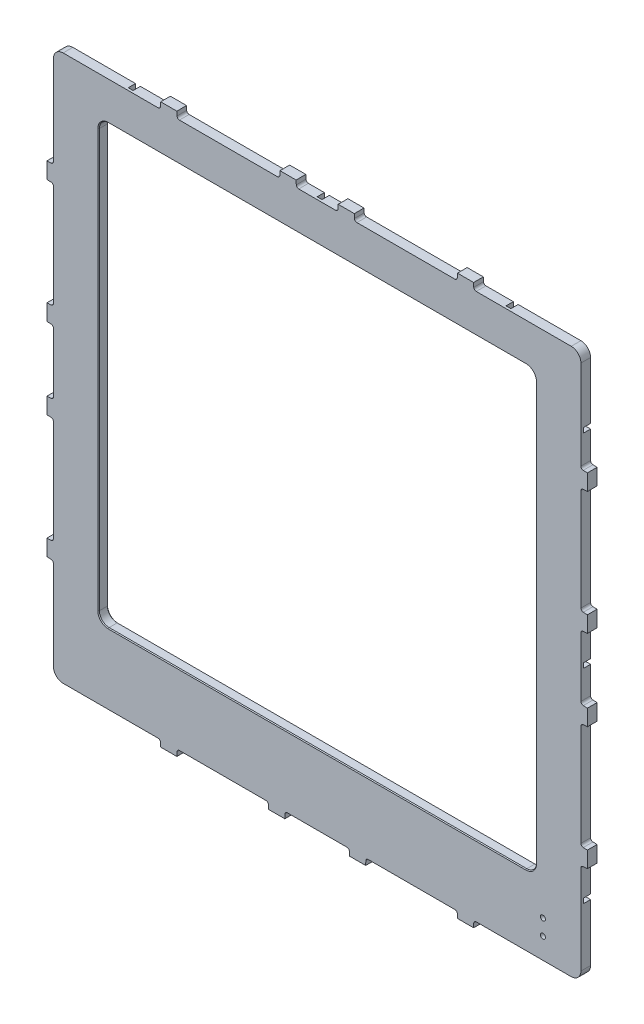
from build123d import *

# Parameters (mm, degrees)
CROQUIS1_W                          = 334.2
CROQUIS1_H                          = 345.6
SALIENTE_EXTRUIR1_DEPTH             = 6
CROQUIS2_W                          = 70.210316922
CROQUIS2_H                          = 4
CORTAR_EXTRUIR1_DEPTH               = 241.454257604
CROQUIS3_W                          = 4
CROQUIS3_H                          = 62.8
CORTAR_EXTRUIR2_DEPTH               = 241.454257604
CROQUIS4_W                          = 4
CROQUIS4_H                          = 66.660316922
CORTAR_EXTRUIR3_DEPTH               = 241.454257604
CROQUIS5_W                          = 66.35
CROQUIS5_H                          = 4
CORTAR_EXTRUIR4_DEPTH               = 241.454257604
CROQUIS6_W                          = 25.720633844
CROQUIS6_H                          = 4
CORTAR_EXTRUIR5_DEPTH               = 241.454257604
CROQUIS7_W                          = 70.210316922
CROQUIS7_H                          = 4
CORTAR_EXTRUIR6_DEPTH               = 241.454257604
CROQUIS8_W                          = 4
CROQUIS8_H                          = 62.8
CORTAR_EXTRUIR7_DEPTH               = 241.454257604
CROQUIS9_W                          = 4
CROQUIS9_H                          = 39.720633844
CORTAR_EXTRUIR8_DEPTH               = 241.454257604
CROQUIS10_W                         = 4
CROQUIS10_H                         = 66.660316922
CORTAR_EXTRUIR9_DEPTH               = 241.454257604
CROQUIS11_W                         = 66.210316922
CROQUIS11_H                         = 4
CORTAR_EXTRUIR10_DEPTH              = 241.454257604
CROQUIS12_W                         = 56.470633844
CROQUIS12_H                         = 4
CORTAR_EXTRUIR11_DEPTH              = 241.454257604
CORTAR_EXTRUIR12_DEPTH              = 4.5
CORTAR_EXTRUIR13_DEPTH              = 4.5
CORTAR_EXTRUIR14_DEPTH              = 4.5
CORTAR_EXTRUIR15_DEPTH              = 4.5
CORTAR_EXTRUIR16_DEPTH              = 4.5
CORTAR_EXTRUIR17_DEPTH              = 4.5
CORTAR_EXTRUIR18_DEPTH              = 4.5
CORTAR_EXTRUIR19_DEPTH              = 4.5
CORTAR_EXTRUIR20_DEPTH              = 4.5
CORTAR_EXTRUIR21_DEPTH              = 4.5
CORTAR_EXTRUIR22_DEPTH              = 4.5
CORTAR_EXTRUIR23_DEPTH              = 4.5
CORTAR_EXTRUIR24_DEPTH              = 4.5
CORTAR_EXTRUIR25_DEPTH              = 4.5
CORTAR_EXTRUIR26_DEPTH              = 241.454257604
CROQUIS29_W                         = 4
CROQUIS29_H                         = 65.720633844
CORTAR_EXTRUIR27_DEPTH              = 241.454257604
CORTAR_EXTRUIR28_DEPTH              = 241.454257604
CROQUIS31_W                         = 63.470633844
CROQUIS31_H                         = 4
CORTAR_EXTRUIR29_DEPTH              = 241.454257604
CORTAR_EXTRUIR30_DEPTH              = 241.454257604
CROQUIS33_W                         = 4
CROQUIS33_H                         = 65.720633844
CORTAR_EXTRUIR31_DEPTH              = 241.454257604
CROQUIS34_W                         = 39.720633844
CROQUIS34_H                         = 4
CORTAR_EXTRUIR32_DEPTH              = 241.454257604
CROQUIS35_W                         = 270.3
CROQUIS35_H                         = 270.251727153
CORTAR_EXTRUIR33_DEPTH              = 241.454257604
NGULO_DE_SALIDA1_ANGLE              = 2
NGULO_DE_SALIDA2_ANGLE              = 2
NGULO_DE_SALIDA3_ANGLE              = 2
NGULO_DE_SALIDA4_ANGLE              = 2
NGULO_DE_SALIDA5_ANGLE              = 2
NGULO_DE_SALIDA6_ANGLE              = 2
NGULO_DE_SALIDA7_ANGLE              = 2
NGULO_DE_SALIDA8_ANGLE              = 2
NGULO_DE_SALIDA9_ANGLE              = 2
NGULO_DE_SALIDA10_ANGLE             = 2
NGULO_DE_SALIDA11_ANGLE             = 2
NGULO_DE_SALIDA12_ANGLE             = 2
NGULO_DE_SALIDA13_ANGLE             = 2
NGULO_DE_SALIDA14_ANGLE             = 2
NGULO_DE_SALIDA15_ANGLE             = 2
NGULO_DE_SALIDA16_ANGLE             = 2
NGULO_DE_SALIDA17_ANGLE             = 2
DI_METRO_DE_TALADRO_3_1_3_1_1_D     = 3.1
DI_METRO_DE_TALADRO_12_0_12_1_D     = 12
DI_METRO_DE_TALADRO_12_0_12_1_DEPTH = 4.5
REDONDEO1_R                         = 6
CHAFL_N1_SIZE                       = 0.5
REDONDEO2_R                         = 1.5


with BuildPart() as part:
    # Croquis1 → Saliente-Extruir1 (new body)
    with BuildSketch(Plane(origin=(0, 0, -3), x_dir=(-1, 0, 0), z_dir=(0, 0, -1))):
        Rectangle(CROQUIS1_W, CROQUIS1_H)
    extrude(amount=-SALIENTE_EXTRUIR1_DEPTH)

    # Croquis2 → Cortar-Extruir1 (cut, through all)
    with BuildSketch(Plane.XY.offset(3)):
        with Locations((-131.994841539, -170.8)):
            Rectangle(CROQUIS2_W, CROQUIS2_H)
    extrude(amount=-CORTAR_EXTRUIR1_DEPTH, mode=Mode.SUBTRACT)

    # Croquis3 → Cortar-Extruir2 (cut, through all)
    with BuildSketch(Plane.XY.offset(3)):
        with Locations((-165.1, -137.4)):
            Rectangle(CROQUIS3_W, CROQUIS3_H)
    extrude(amount=-CORTAR_EXTRUIR2_DEPTH, mode=Mode.SUBTRACT)

    # Croquis4 → Cortar-Extruir3 (cut, through all)
    with BuildSketch(Plane.XY.offset(3)):
        with Locations((-165.1, 139.469841539)):
            Rectangle(CROQUIS4_W, CROQUIS4_H)
    extrude(amount=-CORTAR_EXTRUIR3_DEPTH, mode=Mode.SUBTRACT)

    # Croquis5 → Cortar-Extruir4 (cut, through all)
    with BuildSketch(Plane.XY.offset(3)):
        with Locations((-129.925, 170.8)):
            Rectangle(CROQUIS5_W, CROQUIS5_H)
    extrude(amount=-CORTAR_EXTRUIR4_DEPTH, mode=Mode.SUBTRACT)

    # Croquis6 → Cortar-Extruir5 (cut, through all)
    with BuildSketch(Plane.XY.offset(3)):
        with Locations((0, 170.8)):
            Rectangle(CROQUIS6_W, CROQUIS6_H)
    extrude(amount=-CORTAR_EXTRUIR5_DEPTH, mode=Mode.SUBTRACT)

    # Croquis7 → Cortar-Extruir6 (cut, through all)
    with BuildSketch(Plane.XY.offset(3)):
        with Locations((131.994841539, 170.8)):
            Rectangle(CROQUIS7_W, CROQUIS7_H)
    extrude(amount=-CORTAR_EXTRUIR6_DEPTH, mode=Mode.SUBTRACT)

    # Croquis8 → Cortar-Extruir7 (cut, through all)
    with BuildSketch(Plane.XY.offset(3)):
        with Locations((165.1, 137.4)):
            Rectangle(CROQUIS8_W, CROQUIS8_H)
    extrude(amount=-CORTAR_EXTRUIR7_DEPTH, mode=Mode.SUBTRACT)

    # Croquis9 → Cortar-Extruir8 (cut, through all)
    with BuildSketch(Plane.XY.offset(3)):
        with Locations((165.1, 0)):
            Rectangle(CROQUIS9_W, CROQUIS9_H)
    cortar_extruir8 = extrude(amount=-CORTAR_EXTRUIR8_DEPTH, mode=Mode.SUBTRACT)

    # Croquis10 → Cortar-Extruir9 (cut, through all)
    with BuildSketch(Plane.XY.offset(3)):
        with Locations((165.1, -139.469841539)):
            Rectangle(CROQUIS10_W, CROQUIS10_H)
    extrude(amount=-CORTAR_EXTRUIR9_DEPTH, mode=Mode.SUBTRACT)

    # Croquis11 → Cortar-Extruir10 (cut, through all)
    with BuildSketch(Plane.XY.offset(3)):
        with Locations((129.994841539, -170.8)):
            Rectangle(CROQUIS11_W, CROQUIS11_H)
    extrude(amount=-CORTAR_EXTRUIR10_DEPTH, mode=Mode.SUBTRACT)

    # Croquis12 → Cortar-Extruir11 (cut, through all)
    with BuildSketch(Plane.XY.offset(3)):
        with Locations((58.375, -170.8)):
            Rectangle(CROQUIS12_W, CROQUIS12_H)
    cortar_extruir11 = extrude(amount=-CORTAR_EXTRUIR11_DEPTH, mode=Mode.SUBTRACT)

    # Croquis13 → Cortar-Extruir12 (cut)
    with BuildSketch(Plane(origin=(0, 0, -3), x_dir=(-1, 0, 0), z_dir=(0, 0, -1))):
        with BuildLine():
            Line((-1.5, 168.8), (-1.5, 162.479019946))
            ThreePointArc((-1.5, 162.479019946), (-2.395643924, 161.968245837), (-2.75, 161))
            Line((-2.75, 161), (-2.75, 159.6))
            ThreePointArc((-2.75, 159.6), (-2.395643924, 158.631754163), (-1.5, 158.120980054))
            Line((-1.5, 158.120980054), (1.5, 158.120980054))
            ThreePointArc((1.5, 158.120980054), (2.395643924, 158.631754163), (2.75, 159.6))
            Line((2.75, 159.6), (2.75, 161))
            ThreePointArc((2.75, 161), (2.395643924, 161.968245837), (1.5, 162.479019946))
            Line((1.5, 162.479019946), (1.5, 168.8))
            Line((1.5, 168.8), (-1.5, 168.8))
        make_face()
    extrude(amount=-CORTAR_EXTRUIR12_DEPTH, mode=Mode.SUBTRACT)

    # Croquis14 → Cortar-Extruir13 (cut)
    with BuildSketch(Plane(origin=(0, 0, -3), x_dir=(-1, 0, 0), z_dir=(0, 0, -1))):
        with BuildLine():
            Line((-118.3, 168.8), (-118.3, 162.479019946))
            ThreePointArc((-118.3, 162.479019946), (-119.195643924, 161.968245837), (-119.55, 161))
            Line((-119.55, 161), (-119.55, 159.6))
            ThreePointArc((-119.55, 159.6), (-119.195643924, 158.631754163), (-118.3, 158.120980054))
            Line((-118.3, 158.120980054), (-115.3, 158.120980054))
            ThreePointArc((-115.3, 158.120980054), (-114.404356076, 158.631754163), (-114.05, 159.6))
            Line((-114.05, 159.6), (-114.05, 161))
            ThreePointArc((-114.05, 161), (-114.404356076, 161.968245837), (-115.3, 162.479019946))
            Line((-115.3, 162.479019946), (-115.3, 168.8))
            Line((-115.3, 168.8), (-118.3, 168.8))
        make_face()
    cortar_extruir13 = extrude(amount=-CORTAR_EXTRUIR13_DEPTH, mode=Mode.SUBTRACT)

    # Croquis15 → Cortar-Extruir14 (cut)
    with BuildSketch(Plane(origin=(0, 0, -3), x_dir=(-1, 0, 0), z_dir=(0, 0, -1))):
        with BuildLine():
            Line((-163.1, 124.5), (-156.779019946, 124.5))
            ThreePointArc((-156.779019946, 124.5), (-156.268245837, 123.604356076), (-155.3, 123.25))
            Line((-155.3, 123.25), (-153.9, 123.25))
            ThreePointArc((-153.9, 123.25), (-152.931754163, 123.604356076), (-152.420980054, 124.5))
            Line((-152.420980054, 124.5), (-152.420980054, 127.5))
            ThreePointArc((-152.420980054, 127.5), (-152.931754163, 128.395643924), (-153.9, 128.75))
            Line((-153.9, 128.75), (-155.3, 128.75))
            ThreePointArc((-155.3, 128.75), (-156.268245837, 128.395643924), (-156.779019946, 127.5))
            Line((-156.779019946, 127.5), (-163.1, 127.5))
            Line((-163.1, 127.5), (-163.1, 124.5))
        make_face()
    cortar_extruir14 = extrude(amount=-CORTAR_EXTRUIR14_DEPTH, mode=Mode.SUBTRACT)

    # Croquis16 → Cortar-Extruir15 (cut)
    with BuildSketch(Plane(origin=(0, 0, -3), x_dir=(-1, 0, 0), z_dir=(0, 0, -1))):
        with BuildLine():
            Line((-163.1, -1.5), (-156.779019946, -1.5))
            ThreePointArc((-156.779019946, -1.5), (-156.268245837, -2.395643924), (-155.3, -2.75))
            Line((-155.3, -2.75), (-153.9, -2.75))
            ThreePointArc((-153.9, -2.75), (-152.931754163, -2.395643924), (-152.420980054, -1.5))
            Line((-152.420980054, -1.5), (-152.420980054, 1.5))
            ThreePointArc((-152.420980054, 1.5), (-152.931754163, 2.395643924), (-153.9, 2.75))
            Line((-153.9, 2.75), (-155.3, 2.75))
            ThreePointArc((-155.3, 2.75), (-156.268245837, 2.395643924), (-156.779019946, 1.5))
            Line((-156.779019946, 1.5), (-163.1, 1.5))
            Line((-163.1, 1.5), (-163.1, -1.5))
        make_face()
    cortar_extruir15 = extrude(amount=-CORTAR_EXTRUIR15_DEPTH, mode=Mode.SUBTRACT)

    # Croquis17 → Cortar-Extruir16 (cut)
    with BuildSketch(Plane(origin=(0, 0, -3), x_dir=(-1, 0, 0), z_dir=(0, 0, -1))):
        with BuildLine():
            Line((-163.1, -127.5), (-156.779019946, -127.5))
            ThreePointArc((-156.779019946, -127.5), (-156.268245837, -128.395643924), (-155.3, -128.75))
            Line((-155.3, -128.75), (-153.9, -128.75))
            ThreePointArc((-153.9, -128.75), (-152.931754163, -128.395643924), (-152.420980054, -127.5))
            Line((-152.420980054, -127.5), (-152.420980054, -124.5))
            ThreePointArc((-152.420980054, -124.5), (-152.931754163, -123.604356076), (-153.9, -123.25))
            Line((-153.9, -123.25), (-155.3, -123.25))
            ThreePointArc((-155.3, -123.25), (-156.268245837, -123.604356076), (-156.779019946, -124.5))
            Line((-156.779019946, -124.5), (-163.1, -124.5))
            Line((-163.1, -124.5), (-163.1, -127.5))
        make_face()
    cortar_extruir16 = extrude(amount=-CORTAR_EXTRUIR16_DEPTH, mode=Mode.SUBTRACT)

    # Croquis18 → Cortar-Extruir17 (cut)
    with BuildSketch(Plane(origin=(0, 0, -3), x_dir=(-1, 0, 0), z_dir=(0, 0, -1))):
        with BuildLine():
            Line((-115.3, -168.8), (-115.3, -162.479019946))
            ThreePointArc((-115.3, -162.479019946), (-114.404356076, -161.968245837), (-114.05, -161))
            Line((-114.05, -161), (-114.05, -159.6))
            ThreePointArc((-114.05, -159.6), (-114.404356076, -158.631754163), (-115.3, -158.120980054))
            Line((-115.3, -158.120980054), (-118.3, -158.120980054))
            ThreePointArc((-118.3, -158.120980054), (-119.195643924, -158.631754163), (-119.55, -159.6))
            Line((-119.55, -159.6), (-119.55, -161))
            ThreePointArc((-119.55, -161), (-119.195643924, -161.968245837), (-118.3, -162.479019946))
            Line((-118.3, -162.479019946), (-118.3, -168.8))
            Line((-118.3, -168.8), (-115.3, -168.8))
        make_face()
    cortar_extruir17 = extrude(amount=-CORTAR_EXTRUIR17_DEPTH, mode=Mode.SUBTRACT)

    # Croquis19 → Cortar-Extruir18 (cut)
    with BuildSketch(Plane(origin=(0, 0, -3), x_dir=(-1, 0, 0), z_dir=(0, 0, -1))):
        with BuildLine():
            Line((-56.9, -168.8), (-56.9, -162.479019946))
            ThreePointArc((-56.9, -162.479019946), (-56.004356076, -161.968245837), (-55.65, -161))
            Line((-55.65, -161), (-55.65, -159.6))
            ThreePointArc((-55.65, -159.6), (-56.004356076, -158.631754163), (-56.9, -158.120980054))
            Line((-56.9, -158.120980054), (-59.9, -158.120980054))
            ThreePointArc((-59.9, -158.120980054), (-60.795643924, -158.631754163), (-61.15, -159.6))
            Line((-61.15, -159.6), (-61.15, -161))
            ThreePointArc((-61.15, -161), (-60.795643924, -161.968245837), (-59.9, -162.479019946))
            Line((-59.9, -162.479019946), (-59.9, -168.8))
            Line((-59.9, -168.8), (-56.9, -168.8))
        make_face()
    cortar_extruir18 = extrude(amount=-CORTAR_EXTRUIR18_DEPTH, mode=Mode.SUBTRACT)

    # Croquis20 → Cortar-Extruir19 (cut)
    with BuildSketch(Plane(origin=(0, 0, -3), x_dir=(-1, 0, 0), z_dir=(0, 0, -1))):
        with BuildLine():
            Line((-59.737509594, -158.120980054), (-57.062490406, -158.120980054))
            ThreePointArc((-57.062490406, -158.120980054), (-58.4, -157.3), (-59.737509594, -158.120980054))
        make_face()
    cortar_extruir19 = extrude(amount=-CORTAR_EXTRUIR19_DEPTH, mode=Mode.SUBTRACT)

    # Croquis21 → Cortar-Extruir20 (cut)
    with BuildSketch(Plane(origin=(0, 0, -3), x_dir=(-1, 0, 0), z_dir=(0, 0, -1))):
        with BuildLine():
            Line((-118.137509594, -158.120980054), (-115.462490406, -158.120980054))
            ThreePointArc((-115.462490406, -158.120980054), (-116.8, -157.3), (-118.137509594, -158.120980054))
        make_face()
    cortar_extruir20 = extrude(amount=-CORTAR_EXTRUIR20_DEPTH, mode=Mode.SUBTRACT)

    # Croquis22 → Cortar-Extruir21 (cut)
    with BuildSketch(Plane(origin=(0, 0, -3), x_dir=(-1, 0, 0), z_dir=(0, 0, -1))):
        with BuildLine():
            Line((-152.420980054, -124.662490406), (-152.420980054, -127.337509594))
            ThreePointArc((-152.420980054, -127.337509594), (-151.6, -126), (-152.420980054, -124.662490406))
        make_face()
    cortar_extruir21 = extrude(amount=-CORTAR_EXTRUIR21_DEPTH, mode=Mode.SUBTRACT)

    # Croquis23 → Cortar-Extruir22 (cut)
    with BuildSketch(Plane(origin=(0, 0, -3), x_dir=(-1, 0, 0), z_dir=(0, 0, -1))):
        with BuildLine():
            Line((-152.420980054, 1.337509594), (-152.420980054, -1.337509594))
            ThreePointArc((-152.420980054, -1.337509594), (-151.6, 0), (-152.420980054, 1.337509594))
        make_face()
    cortar_extruir22 = extrude(amount=-CORTAR_EXTRUIR22_DEPTH, mode=Mode.SUBTRACT)

    # Croquis24 → Cortar-Extruir23 (cut)
    with BuildSketch(Plane(origin=(0, 0, -3), x_dir=(-1, 0, 0), z_dir=(0, 0, -1))):
        with BuildLine():
            Line((-152.420980054, 127.337509594), (-152.420980054, 124.662490406))
            ThreePointArc((-152.420980054, 124.662490406), (-151.6, 126), (-152.420980054, 127.337509594))
        make_face()
    cortar_extruir23 = extrude(amount=-CORTAR_EXTRUIR23_DEPTH, mode=Mode.SUBTRACT)

    # Croquis25 → Cortar-Extruir24 (cut)
    with BuildSketch(Plane(origin=(0, 0, -3), x_dir=(-1, 0, 0), z_dir=(0, 0, -1))):
        with BuildLine():
            Line((-115.462490406, 158.120980054), (-118.137509594, 158.120980054))
            ThreePointArc((-118.137509594, 158.120980054), (-116.8, 157.3), (-115.462490406, 158.120980054))
        make_face()
    cortar_extruir24 = extrude(amount=-CORTAR_EXTRUIR24_DEPTH, mode=Mode.SUBTRACT)

    # Simetría1: Cortar-Extruir8, Cortar-Extruir11, Cortar-Extruir13, Cortar-Extruir14, Cortar-Extruir15, Cortar-Extruir16, Cortar-Extruir17, Cortar-Extruir18, Cortar-Extruir19, Cortar-Extruir20, Cortar-Extruir21, Cortar-Extruir22, Cortar-Extruir23, Cortar-Extruir24 across plane
    add(cortar_extruir8.mirror(Plane(origin=(0, 0, 0), x_dir=(0, 0, 1), z_dir=(1, 0, 0))), mode=Mode.SUBTRACT)
    add(cortar_extruir11.mirror(Plane(origin=(0, 0, 0), x_dir=(0, 0, 1), z_dir=(1, 0, 0))), mode=Mode.SUBTRACT)
    add(cortar_extruir13.mirror(Plane(origin=(0, 0, 0), x_dir=(0, 0, 1), z_dir=(1, 0, 0))), mode=Mode.SUBTRACT)
    add(cortar_extruir14.mirror(Plane(origin=(0, 0, 0), x_dir=(0, 0, 1), z_dir=(1, 0, 0))), mode=Mode.SUBTRACT)
    add(cortar_extruir15.mirror(Plane(origin=(0, 0, 0), x_dir=(0, 0, 1), z_dir=(1, 0, 0))), mode=Mode.SUBTRACT)
    add(cortar_extruir16.mirror(Plane(origin=(0, 0, 0), x_dir=(0, 0, 1), z_dir=(1, 0, 0))), mode=Mode.SUBTRACT)
    add(cortar_extruir17.mirror(Plane(origin=(0, 0, 0), x_dir=(0, 0, 1), z_dir=(1, 0, 0))), mode=Mode.SUBTRACT)
    add(cortar_extruir18.mirror(Plane(origin=(0, 0, 0), x_dir=(0, 0, 1), z_dir=(1, 0, 0))), mode=Mode.SUBTRACT)
    add(cortar_extruir19.mirror(Plane(origin=(0, 0, 0), x_dir=(0, 0, 1), z_dir=(1, 0, 0))), mode=Mode.SUBTRACT)
    add(cortar_extruir20.mirror(Plane(origin=(0, 0, 0), x_dir=(0, 0, 1), z_dir=(1, 0, 0))), mode=Mode.SUBTRACT)
    add(cortar_extruir21.mirror(Plane(origin=(0, 0, 0), x_dir=(0, 0, 1), z_dir=(1, 0, 0))), mode=Mode.SUBTRACT)
    add(cortar_extruir22.mirror(Plane(origin=(0, 0, 0), x_dir=(0, 0, 1), z_dir=(1, 0, 0))), mode=Mode.SUBTRACT)
    add(cortar_extruir23.mirror(Plane(origin=(0, 0, 0), x_dir=(0, 0, 1), z_dir=(1, 0, 0))), mode=Mode.SUBTRACT)
    add(cortar_extruir24.mirror(Plane(origin=(0, 0, 0), x_dir=(0, 0, 1), z_dir=(1, 0, 0))), mode=Mode.SUBTRACT)

    # Croquis27 → Cortar-Extruir25 (cut)
    with BuildSketch(Plane(origin=(0, 0, -3), x_dir=(-1, 0, 0), z_dir=(0, 0, -1))):
        with BuildLine():
            Line((1.337509594, 158.120980054), (-1.337509594, 158.120980054))
            ThreePointArc((-1.337509594, 158.120980054), (0, 157.3), (1.337509594, 158.120980054))
        make_face()
    extrude(amount=-CORTAR_EXTRUIR25_DEPTH, mode=Mode.SUBTRACT)

    # Croquis28 → Cortar-Extruir26 (cut, through all)
    with BuildSketch(Plane.XY.offset(3)):
        Polygon((-167.1, -30), (-167.1, -96), (-163.1, -96), (-163.1, -30.139683078), align=None)
    extrude(amount=-CORTAR_EXTRUIR26_DEPTH, mode=Mode.SUBTRACT)

    # Croquis29 → Cortar-Extruir27 (cut, through all)
    with BuildSketch(Plane.XY.offset(3)):
        with Locations((-165.1, 63)):
            Rectangle(CROQUIS29_W, CROQUIS29_H)
    extrude(amount=-CORTAR_EXTRUIR27_DEPTH, mode=Mode.SUBTRACT)

    # Croquis30 → Cortar-Extruir28 (cut, through all)
    with BuildSketch(Plane.XY.offset(3)):
        Polygon((-23, 172.8), (-86.75, 172.8), (-86.75, 168.8), (-23.139683078, 168.8), align=None)
    extrude(amount=-CORTAR_EXTRUIR28_DEPTH, mode=Mode.SUBTRACT)

    # Croquis31 → Cortar-Extruir29 (cut, through all)
    with BuildSketch(Plane.XY.offset(3)):
        with Locations((54.875, 170.8)):
            Rectangle(CROQUIS31_W, CROQUIS31_H)
    extrude(amount=-CORTAR_EXTRUIR29_DEPTH, mode=Mode.SUBTRACT)

    # Croquis32 → Cortar-Extruir30 (cut, through all)
    with BuildSketch(Plane.XY.offset(3)):
        Polygon((167.1, 96), (163.1, 96), (163.1, 30.139683078), (167.1, 30), align=None)
    extrude(amount=-CORTAR_EXTRUIR30_DEPTH, mode=Mode.SUBTRACT)

    # Croquis33 → Cortar-Extruir31 (cut, through all)
    with BuildSketch(Plane.XY.offset(3)):
        with Locations((165.1, -63)):
            Rectangle(CROQUIS33_W, CROQUIS33_H)
    extrude(amount=-CORTAR_EXTRUIR31_DEPTH, mode=Mode.SUBTRACT)

    # Croquis34 → Cortar-Extruir32 (cut, through all)
    with BuildSketch(Plane.XY.offset(3)):
        with Locations((0, -170.8)):
            Rectangle(CROQUIS34_W, CROQUIS34_H)
    extrude(amount=-CORTAR_EXTRUIR32_DEPTH, mode=Mode.SUBTRACT)

    # Croquis35 → Cortar-Extruir33 (cut, through all)
    with BuildSketch(Plane.XY.offset(3)):
        with Locations((0, 9.934136424)):
            Rectangle(CROQUIS35_W, CROQUIS35_H)
    extrude(amount=-CORTAR_EXTRUIR33_DEPTH, mode=Mode.SUBTRACT)

    # Ángulo de salida1
    ngulo_de_salida1_faces = [part.faces().sort_by_distance(p)[0] for p in [
        (96.889683078, -170.8, 0),
    ]]
    draft(ngulo_de_salida1_faces, Plane(origin=(163.1, -168.8, -3), x_dir=(0, 0, -1), z_dir=(0, -1, 0)), NGULO_DE_SALIDA1_ANGLE)

    # Ángulo de salida2
    ngulo_de_salida2_faces = [part.faces().sort_by_distance(p)[0] for p in [
        (165.1, -106.139683078, 0),
    ]]
    draft(ngulo_de_salida2_faces, Plane(origin=(163.1, -106.139683078, -3), x_dir=(0, 1, 0), z_dir=(1, 0, 0)), NGULO_DE_SALIDA2_ANGLE)

    # Ángulo de salida3
    ngulo_de_salida3_faces = [part.faces().sort_by_distance(p)[0] for p in [
        (96.889683078, 170.8, 0),
    ]]
    draft(ngulo_de_salida3_faces, Plane(origin=(96.889683078, 168.8, -3), x_dir=(1, 0, 0), z_dir=(0, 1, 0)), NGULO_DE_SALIDA3_ANGLE)

    # Ángulo de salida4
    ngulo_de_salida4_faces = [part.faces().sort_by_distance(p)[0] for p in [
        (-165.1, 106.139683078, 0),
    ]]
    draft(ngulo_de_salida4_faces, Plane(origin=(-163.1, 106.139683078, -3), x_dir=(0, 0, -1), z_dir=(-1, 0, 0)), NGULO_DE_SALIDA4_ANGLE)

    # Ángulo de salida5
    ngulo_de_salida5_faces = [part.faces().sort_by_distance(p)[0] for p in [
        (-96.889683078, -170.8, 0),
    ]]
    draft(ngulo_de_salida5_faces, Plane(origin=(-96.889683078, -168.8, -3), x_dir=(0, 0, -1), z_dir=(0, -1, 0)), NGULO_DE_SALIDA5_ANGLE)

    # Ángulo de salida6
    ngulo_de_salida6_faces = [part.faces().sort_by_distance(p)[0] for p in [
        (19.860316922, -170.8, 0),
        (-19.860316922, -170.8, 0),
    ]]
    draft(ngulo_de_salida6_faces, Plane(origin=(19.860316922, -168.8, -3), x_dir=(0, 0, -1), z_dir=(0, -1, 0)), NGULO_DE_SALIDA6_ANGLE)

    # Ángulo de salida7
    ngulo_de_salida7_faces = [part.faces().sort_by_distance(p)[0] for p in [
        (165.1, -30.139683078, 0),
        (165.1, -95.860316922, 0),
    ]]
    draft(ngulo_de_salida7_faces, Plane(origin=(163.1, -30.139683078, -3), x_dir=(0, 1, 0), z_dir=(1, 0, 0)), NGULO_DE_SALIDA7_ANGLE)

    # Ángulo de salida8
    ngulo_de_salida8_faces = [part.faces().sort_by_distance(p)[0] for p in [
        (165.1, 96, 0),
        (165.1, 106, 0),
    ]]
    draft(ngulo_de_salida8_faces, Plane(origin=(167.1, 172.8, 3), x_dir=(0, 0, 1), z_dir=(1, 0, 0)), NGULO_DE_SALIDA8_ANGLE)

    # Ángulo de salida9
    ngulo_de_salida9_faces = [part.faces().sort_by_distance(p)[0] for p in [
        (23.139683078, 170.8, 0),
        (86.610316922, 170.8, 0),
    ]]
    draft(ngulo_de_salida9_faces, Plane(origin=(23.139683078, 168.8, -3), x_dir=(0, 0, 1), z_dir=(0, 1, 0)), NGULO_DE_SALIDA9_ANGLE)

    # Ángulo de salida10
    ngulo_de_salida10_faces = [part.faces().sort_by_distance(p)[0] for p in [
        (-96.75, 170.8, 0),
        (-86.75, 170.8, 0),
    ]]
    draft(ngulo_de_salida10_faces, Plane(origin=(-167.1, 172.8, 3), x_dir=(1, 0, 0), z_dir=(0, 1, 0)), NGULO_DE_SALIDA10_ANGLE)

    # Ángulo de salida11
    ngulo_de_salida11_faces = [part.faces().sort_by_distance(p)[0] for p in [
        (-165.1, 30.139683078, 0),
        (-165.1, 95.860316922, 0),
    ]]
    draft(ngulo_de_salida11_faces, Plane(origin=(-163.1, 30.139683078, -3), x_dir=(0, 0, -1), z_dir=(-1, 0, 0)), NGULO_DE_SALIDA11_ANGLE)

    # Ángulo de salida12
    ngulo_de_salida12_faces = [part.faces().sort_by_distance(p)[0] for p in [
        (-165.1, -106, 0),
        (-165.1, -96, 0),
    ]]
    draft(ngulo_de_salida12_faces, Plane(origin=(-167.1, -172.8, 3), x_dir=(0, 0, -1), z_dir=(-1, 0, 0)), NGULO_DE_SALIDA12_ANGLE)

    # Ángulo de salida13
    ngulo_de_salida13_faces = [part.faces().sort_by_distance(p)[0] for p in [
        (30.139683078, -170.8, 0),
        (86.610316922, -170.8, 0),
    ]]
    draft(ngulo_de_salida13_faces, Plane(origin=(86.610316922, -168.8, -3), x_dir=(0, 0, -1), z_dir=(0, -1, 0)), NGULO_DE_SALIDA13_ANGLE)

    # Ángulo de salida14
    ngulo_de_salida14_faces = [part.faces().sort_by_distance(p)[0] for p in [
        (165.1, -19.860316922, 0),
        (165.1, 19.860316922, 0),
    ]]
    draft(ngulo_de_salida14_faces, Plane(origin=(163.1, 19.860316922, -3), x_dir=(0, 1, 0), z_dir=(1, 0, 0)), NGULO_DE_SALIDA14_ANGLE)

    # Ángulo de salida15
    ngulo_de_salida15_faces = [part.faces().sort_by_distance(p)[0] for p in [
        (12.860316922, 170.8, 0),
        (-12.860316922, 170.8, 0),
    ]]
    draft(ngulo_de_salida15_faces, Plane(origin=(-12.860316922, 168.8, -3), x_dir=(1, 0, 0), z_dir=(0, 1, 0)), NGULO_DE_SALIDA15_ANGLE)

    # Ángulo de salida16
    ngulo_de_salida16_faces = [part.faces().sort_by_distance(p)[0] for p in [
        (-165.1, 19.860316922, 0),
        (-165.1, -19.860316922, 0),
    ]]
    draft(ngulo_de_salida16_faces, Plane(origin=(-163.1, 19.860316922, -3), x_dir=(0, -1, 0), z_dir=(-1, 0, 0)), NGULO_DE_SALIDA16_ANGLE)

    # Ángulo de salida17
    ngulo_de_salida17_faces = [part.faces().sort_by_distance(p)[0] for p in [
        (-86.610316922, -170.8, 0),
        (-30.139683078, -170.8, 0),
    ]]
    draft(ngulo_de_salida17_faces, Plane(origin=(-86.610316922, -168.8, -3), x_dir=(0, 0, -1), z_dir=(0, -1, 0)), NGULO_DE_SALIDA17_ANGLE)

    # Diámetro de taladro Ø3.1 (3.1)1 (through all)
    with Locations(Plane.XY.offset(3)):
        with Locations((139.6, -155.8), (139.6, -146.1)):
            Hole(DI_METRO_DE_TALADRO_3_1_3_1_1_D / 2)

    # Diámetro de taladro Ø12.0 (12)1
    with Locations(Plane(origin=(0, 0, -3), x_dir=(-1, 0, 0), z_dir=(0, 0, -1))):
        with Locations((80, -148), (-80, -148)):
            Hole(DI_METRO_DE_TALADRO_12_0_12_1_D / 2, depth=DI_METRO_DE_TALADRO_12_0_12_1_DEPTH)

    # Redondeo1
    redondeo1_edges = [part.edges().sort_by_distance(p)[0] for p in [
        (-163.1, 168.8, 0),
        (163.1, -168.8, 0),
        (-163.1, -168.8, 0),
        (163.1, 168.8, 0),
        (-135.15, 145.06, 0),
        (135.15, 145.06, 0),
        (-135.15, -125.191727153, 0),
        (135.15, -125.191727153, 0),
    ]]
    fillet(redondeo1_edges, radius=REDONDEO1_R)

    # Chaflán1
    chafl_n1_edges = [part.edges().sort_by_distance(p)[0] for p in [
        (-133.392640687, -123.43436784, 3),
        (0, -125.191727153, 3),
        (-135.15, 9.934136424, 3),
        (133.392640687, -123.43436784, 3),
        (-133.392640687, 143.302640687, 3),
        (135.15, 9.934136424, 3),
        (0, 145.06, 3),
        (133.392640687, 143.302640687, 3),
        (-133.392640687, -123.43436784, -3),
        (0, -125.191727153, -3),
        (-135.15, 9.934136424, -3),
        (133.392640687, -123.43436784, -3),
        (-133.392640687, 143.302640687, -3),
        (135.15, 9.934136424, -3),
        (0, 145.06, -3),
        (133.392640687, 143.302640687, -3),
    ]]
    chamfer(chafl_n1_edges, length=CHAFL_N1_SIZE)

    # Redondeo2
    redondeo2_edges = [part.edges().sort_by_distance(p)[0] for p in [
        (-86.610316922, 168.8, 0),
        (-163.1, -30.139683078, 0),
        (-96.889683078, -168.8, 0),
        (-163.1, 95.860316922, 0),
        (23.139683078, 168.8, 0),
        (19.860316922, -168.8, 0),
        (-30.139683078, -168.8, 0),
        (-163.1, -106.139683078, 0),
        (-163.1, 19.860316922, 0),
        (-12.860316922, 168.8, 0),
        (86.610316922, -168.8, 0),
        (-19.860316922, -168.8, 0),
        (-86.610316922, -168.8, 0),
        (-163.1, -95.860316922, 0),
        (-163.1, -19.860316922, 0),
        (-163.1, 30.139683078, 0),
        (-163.1, 106.139683078, 0),
        (-96.889683078, 168.8, 0),
        (96.889683078, 168.8, 0),
        (-23.139683078, 168.8, 0),
        (163.1, 106.139683078, 0),
        (12.860316922, 168.8, 0),
        (163.1, 30.139683078, 0),
        (86.610316922, 168.8, 0),
        (163.1, -19.860316922, 0),
        (163.1, -95.860316922, 0),
        (163.1, 95.860316922, 0),
        (163.1, 19.860316922, 0),
        (163.1, -30.139683078, 0),
        (163.1, -106.139683078, 0),
        (96.889683078, -168.8, 0),
        (30.139683078, -168.8, 0),
    ]]
    fillet(redondeo2_edges, radius=REDONDEO2_R)


solid = part.part
